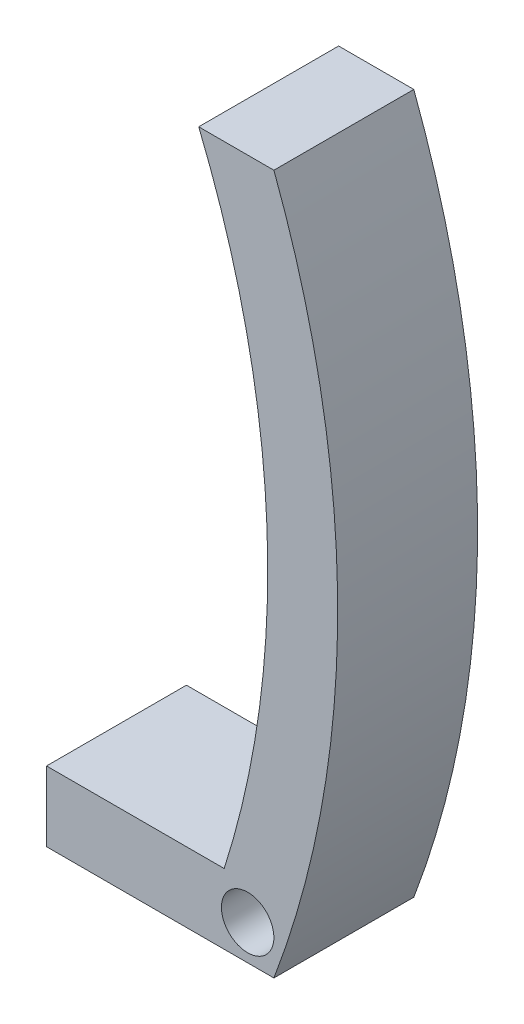
from build123d import *

# Parameters (mm, degrees)
BOSS_EXTRUDE1_DEPTH     = 10.16
CUT_EXTRUDE1_DEPTH      = 56.954376943
CUT_EXTRUDE1_DEPTH_BACK = 56.954376943
SKETCH2_R               = 1.905


with BuildPart() as part:
    # Sketch1 → Boss-Extrude1 (new body)
    with BuildSketch(Plane.XY):
        with BuildLine():
            Line((0, 0), (16.51, 0))
            ThreePointArc((16.51, 0), (21.143005914, 25.4), (16.51, 50.8))
            Line((16.51, 50.8), (11.050639123, 50.8))
            ThreePointArc((11.050639123, 50.8), (16.008340976, 28.103171462), (12.900542854, 5.08))
            Line((12.900542854, 5.08), (0, 5.08))
            Line((0, 5.08), (0, 0))
        make_face()
    extrude(amount=BOSS_EXTRUDE1_DEPTH)

    # Sketch2 → Cut-Extrude1 (cut, two sides: drawn at the far end of the back side and taken through both)
    with BuildSketch(Plane.XY.offset(10.16).offset(-CUT_EXTRUDE1_DEPTH_BACK)):
        with Locations((14.605, 2.54)):
            Circle(SKETCH2_R)
    extrude(amount=CUT_EXTRUDE1_DEPTH + CUT_EXTRUDE1_DEPTH_BACK, mode=Mode.SUBTRACT)


solid = part.part
